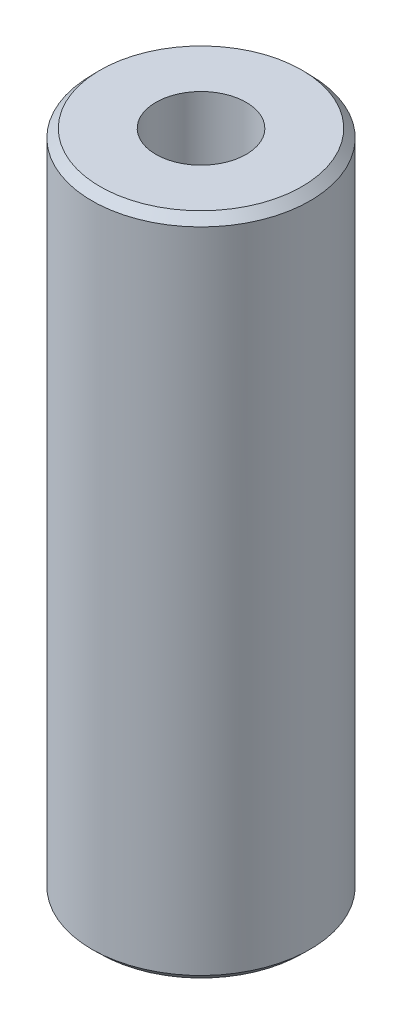
from build123d import *
from OCP.BRepFilletAPI import BRepFilletAPI_MakeChamfer

# Parameters (mm, degrees)
SKETCH1_R           = 20
BOSS_EXTRUDE1_DEPTH = 121.924233264
SKETCH2_R           = 8.284207373
CUT_EXTRUDE1_DEPTH  = 126.161969691
CHAMFER1_SIZE       = 1.524934067
CHAMFER1_SIZE2      = 1.484777693


with BuildPart() as part:
    # Sketch1 → Boss-Extrude1 (new body)
    with BuildSketch(Plane(origin=(0, 0, 0), x_dir=(1, 0, 0), z_dir=(0, 1, 0))):
        Circle(SKETCH1_R)
    extrude(amount=BOSS_EXTRUDE1_DEPTH)

    # Sketch2 → Cut-Extrude1 (cut, through all)
    with BuildSketch(Plane(origin=(0, 0, 0), x_dir=(1, 0, 0), z_dir=(0, 1, 0))):
        Circle(SKETCH2_R)
    extrude(amount=CUT_EXTRUDE1_DEPTH, mode=Mode.SUBTRACT)

    # Chamfer1: one chamfer whose edges measure the first distance from different faces: ONE call of the kernel's chamfer builder (chamfer() names one face for all edges)
    chamfer1_edges_1 = [part.edges().sort_by_distance(p)[0] for p in [
        (-20, 121.924233264, 0),
    ]]
    chamfer1_side_1 = [part.faces().sort_by_distance(p)[0] for p in [
        (-20, 60.962116632, 0),
    ]]
    chamfer1_edges_2 = [part.edges().sort_by_distance(p)[0] for p in [
        (-20, 0, 0),
    ]]
    chamfer1_side_2 = [part.faces().sort_by_distance(p)[0] for p in [
        (-19.434314575, 0, 0),
    ]]
    chamfer1 = BRepFilletAPI_MakeChamfer(part.part.solid().wrapped)
    for e in chamfer1_edges_1:
        chamfer1.Add(CHAMFER1_SIZE, CHAMFER1_SIZE2, e.wrapped, chamfer1_side_1[0].wrapped)  # the first distance lies on this face
    for e in chamfer1_edges_2:
        chamfer1.Add(CHAMFER1_SIZE, CHAMFER1_SIZE2, e.wrapped, chamfer1_side_2[0].wrapped)  # the first distance lies on this face
    add(Compound.cast(chamfer1.Shape()), mode=Mode.REPLACE)


solid = part.part
